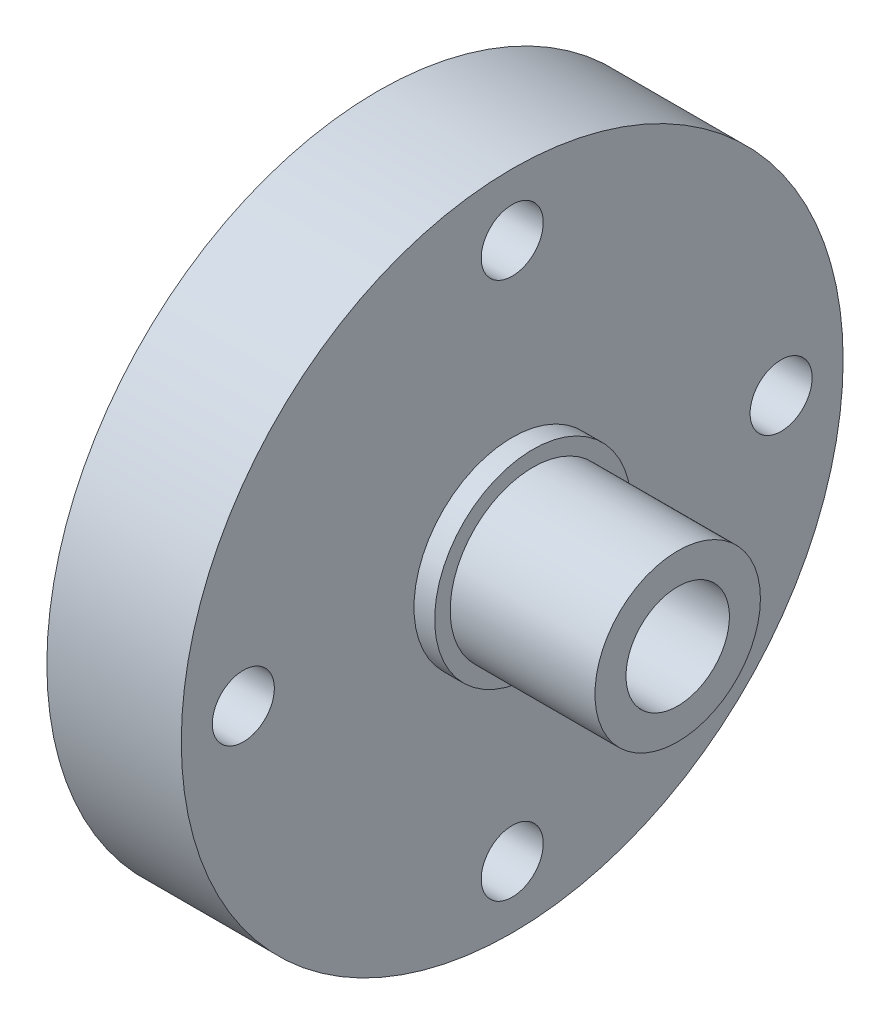
from build123d import *

# Parameters (mm, degrees)
SKETCH1_R           = 16
SKETCH1_R_2         = 2.5
BOSS_EXTRUDE1_DEPTH = 6.5
SKETCH2_R           = 1.5
CUT_EXTRUDE1_DEPTH  = 24.542514734
SKETCH4_R           = 4.75
SKETCH4_R_2         = 2.5
BOSS_EXTRUDE2_DEPTH = 1
SKETCH5_R           = 4
SKETCH5_R_2         = 2.5
BOSS_EXTRUDE3_DEPTH = 7


with BuildPart() as part:
    # Sketch1 → Boss-Extrude1 (new body)
    with BuildSketch(Plane(origin=(0, 0, 0), x_dir=(0, 0, -1), z_dir=(1, 0, 0))):
        Circle(SKETCH1_R)
        Circle(SKETCH1_R_2, mode=Mode.SUBTRACT)
    extrude(amount=BOSS_EXTRUDE1_DEPTH)

    # Sketch2 → Cut-Extrude1 (cut, through all)
    with BuildSketch(Plane(origin=(6.5, 0, 0), x_dir=(0, 0, -1), z_dir=(1, 0, 0))):
        with Locations((0, 13)):
            Circle(SKETCH2_R)
        with Locations((13, 0)):
            Circle(SKETCH2_R)
        with Locations((0, -13)):
            Circle(SKETCH2_R)
        with Locations((-13, 0)):
            Circle(SKETCH2_R)
    extrude(amount=-CUT_EXTRUDE1_DEPTH, mode=Mode.SUBTRACT)

    # Sketch4 → Boss-Extrude2 (add)
    with BuildSketch(Plane(origin=(6.5, 0, 0), x_dir=(0, 0, -1), z_dir=(1, 0, 0))):
        Circle(SKETCH4_R)
        Circle(SKETCH4_R_2, mode=Mode.SUBTRACT)
    extrude(amount=BOSS_EXTRUDE2_DEPTH)

    # Sketch5 → Boss-Extrude3 (add)
    with BuildSketch(Plane(origin=(7.5, 0, 0), x_dir=(0, 0, -1), z_dir=(1, 0, 0))):
        Circle(SKETCH5_R)
        Circle(SKETCH5_R_2, mode=Mode.SUBTRACT)
    extrude(amount=BOSS_EXTRUDE3_DEPTH)


solid = part.part
